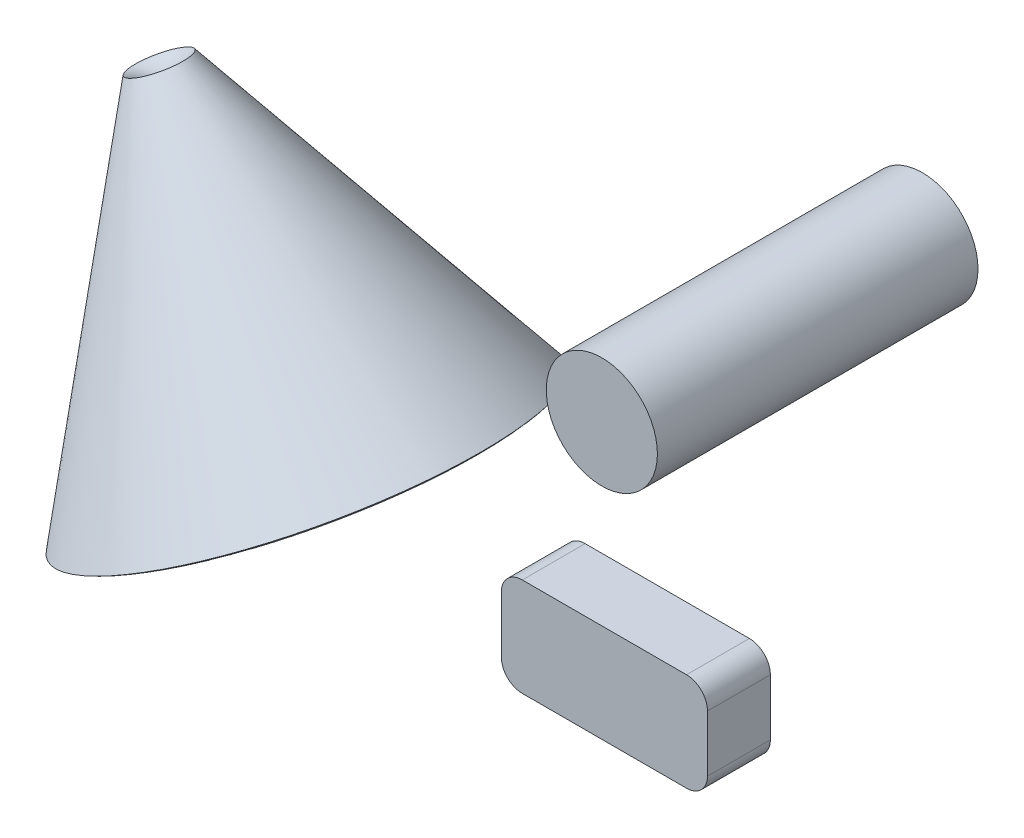
from build123d import *

# Parameters (mm, degrees)
SKETCH1_W           = 10
SKETCH1_H           = 168.549429456
FILLET1_R           = 10
SKETCH2_R           = 26.521587753
BOSS_EXTRUDE1_DEPTH = 153
BOSS_EXTRUDE2_DEPTH = 30


with BuildPart() as part:
    # Sketch1 → Revolve-Thin1 (revolve)
    with BuildSketch(Plane.XY, mode=Mode.PRIVATE) as revolve_thin1_sk:
        with Locations((184.679193334, 168.423310959)):
            Rectangle(SKETCH1_W, SKETCH1_H)
    revolve(revolve_thin1_sk.sketch.rotate(Axis((194.453275648, 252.698025687, 0), (0.48171451341834604, -0.8763282076722888, 0)), 180), axis=Axis((194.453275648, 252.698025687, 0), (0.48171451341834604, -0.8763282076722888, 0)))

    # Fillet1
    fillet1_edges = [part.edges().sort_by_distance(p)[0] for p in [
        (189.679193334, 252.698025687, 0),
        (189.679193334, 84.148596231, 0),
    ]]
    fillet(fillet1_edges, radius=FILLET1_R - 0.0001)  # a hair under: the kernel refuses the full size


with BuildPart() as body_2:
    # Sketch2 → Boss-Extrude1 (new body)
    with BuildSketch(Plane.XY):
        with Locations((402.293944257, 216.076736945)):
            Circle(SKETCH2_R)
    extrude(amount=-BOSS_EXTRUDE1_DEPTH)


with BuildPart() as body_3:
    # Sketch3 → Boss-Extrude2 (new body)
    with BuildSketch(Plane.XY):
        with BuildLine():
            Line((394.330774187, 161.789494026), (472.718965476, 161.789494026))
            ThreePointArc((472.718965476, 161.789494026), (479.790033288, 158.860561838), (482.718965476, 151.789494026))
            Line((482.718965476, 151.789494026), (482.718965476, 124.883495853))
            ThreePointArc((482.718965476, 124.883495853), (479.790033288, 117.812428042), (472.718965476, 114.883495853))
            Line((472.718965476, 114.883495853), (394.330774187, 114.883495853))
            ThreePointArc((394.330774187, 114.883495853), (387.259706375, 117.812428042), (384.330774187, 124.883495853))
            Line((384.330774187, 124.883495853), (384.330774187, 151.789494026))
            ThreePointArc((384.330774187, 151.789494026), (387.259706375, 158.860561838), (394.330774187, 161.789494026))
        make_face()
    extrude(amount=BOSS_EXTRUDE2_DEPTH)


solid = Compound([part.part, body_2.part, body_3.part])
